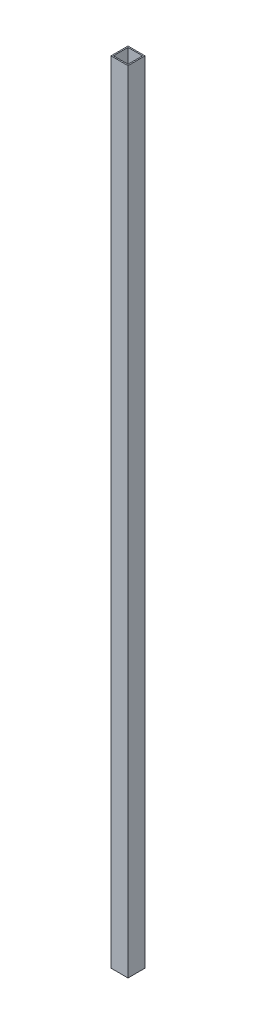
from build123d import *

# Parameters (mm, degrees)
SKETCH_1_W      = 14
SKETCH_1_H      = 14
SKETCH_1_W_2    = 12
SKETCH_1_H_2    = 12
EXTRUDE_1_DEPTH = 650


with BuildPart() as part:
    # Эскиз1 → Бобышка-Вытянуть1 (new body)
    with BuildSketch(Plane(origin=(0, 0, 0), x_dir=(1, 0, 0), z_dir=(0, 1, 0))):
        Rectangle(SKETCH_1_W, SKETCH_1_H)
        Rectangle(SKETCH_1_W_2, SKETCH_1_H_2, mode=Mode.SUBTRACT)
    extrude(amount=EXTRUDE_1_DEPTH)


solid = part.part
